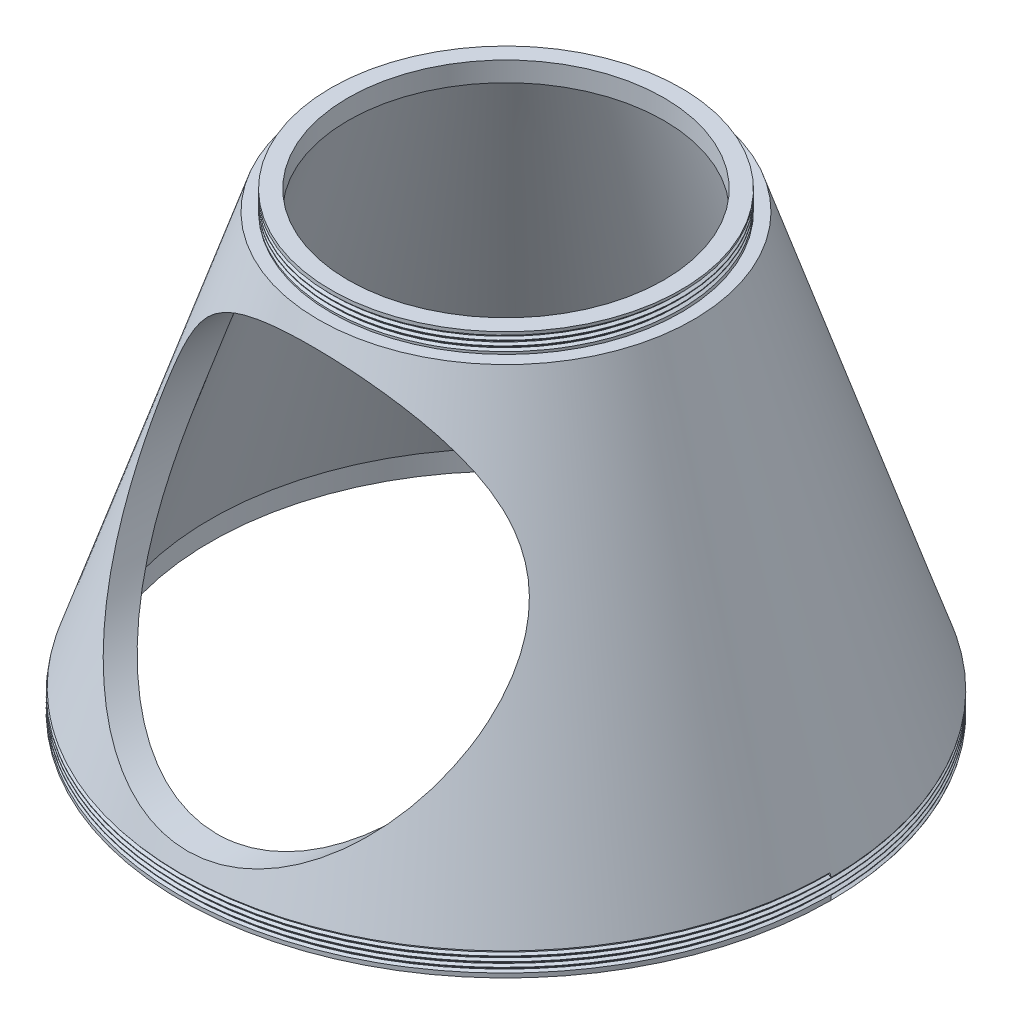
from build123d import *
from build123d.topology import SkipClean

# Parameters (mm, degrees)
SKETCH6_R            = 9.525
SKETCH6_R_2          = 7.65
BOSS_EXTRUDE3_DEPTH  = 46.25
SKETCH12_R           = 16.525
SKETCH12_R_2         = 15.025
BOSS_EXTRUDE10_DEPTH = 1
THREAD1_PITCH        = 0.25
CUT_EXTRUDE1_START   = -60
SKETCH15_R           = 7.65
CUT_EXTRUDE1_DEPTH   = 60
SKETCH17_R           = 7.65
SKETCH17_R_2         = 6
BOSS_EXTRUDE12_DEPTH = 1
SKETCH18_R           = 9.525
SKETCH18_R_2         = 8.025
BOSS_EXTRUDE14_DEPTH = 1
CUT_EXTRUDE2_START   = -1
SKETCH19_R           = 9.525
SKETCH19_R_2         = 8.895
CUT_EXTRUDE2_DEPTH   = 1
THREAD2_PITCH        = 0.25
CUT_EXTRUDE3_START   = -53
SKETCH20_R           = 9.525
CUT_EXTRUDE3_DEPTH   = 53


with BuildPart() as part:
    # Sketch6 → Boss-Extrude3 (new body)
    with BuildSketch(Plane.XY):
        Circle(SKETCH6_R)
        Circle(SKETCH6_R_2, mode=Mode.SUBTRACT)
    extrude(amount=BOSS_EXTRUDE3_DEPTH)

    # Sketch10 → Revolve1 (revolve)
    with BuildSketch(Plane(origin=(0, 0, 0), x_dir=(0, 0, -1), z_dir=(1, 0, 0))):
        Polygon((-8.5, -10.525), (-1.5, 10.525), (0, 10.525), (-7, -10.525), align=None)
    revolve(axis=Axis((0, 15.633745637, -8.025), (0, -1, 0)))

    # Sketch12 → Boss-Extrude10 (add)
    with BuildSketch(Plane.XZ.offset(10.525)):
        with Locations(Location((0, -8.025, 0), (0, 0, 270))):
            Circle(SKETCH12_R)
        with Locations(Location((0, -8.025, 0), (0, 0, 90))):
            Circle(SKETCH12_R_2, mode=Mode.SUBTRACT)
    extrude(amount=BOSS_EXTRUDE10_DEPTH)

    # Thread1: arcs per turn and ends read off the stored shape
    # Thread1: the profile of Thread Profile1 profile screwed along a right-hand helix through 4 turns, 6 arcs to a turn; built about Z, then put on its axis
    thread1_z = Axis((0, 0, 0), (0, 0, 1))
    thread1_corners = [(16.5253, 0, -0.000173205), (16.5253, 0, 0.218923204), (16.389683531, 0, 0.140625), (16.389683531, 0, 0.078125)]
    with BuildLine(mode=Mode.PRIVATE) as thread1_profile:
        Line(thread1_corners[0], thread1_corners[1])
        Line(thread1_corners[1], thread1_corners[2])
        Line(thread1_corners[2], thread1_corners[3])
        Line(thread1_corners[3], thread1_corners[0])
    thread1_cap = Face(thread1_profile.wire())
    thread1_turn_angles = [0, 30, 60, 90, 120, 150, 180, 210, 240, 270, 300, 330, 360]
    thread1_turn_weights = [1, 0.8660254037844387, 1, 0.8660254037844387, 1, 0.8660254037844387, 1, 0.8660254037844387, 1, 0.8660254037844387, 1, 0.8660254037844387, 1]
    thread1_turn_rails = [Edge.make_bspline([Vector(p[0], p[1], 0).rotate(thread1_z, thread1_turn_angles[k]) / thread1_turn_weights[k] + Vector(0, 0, p[2] + THREAD1_PITCH * thread1_turn_angles[k] / 360) for k in range(13)], [0, 0, 0, 1, 1, 2, 2, 3, 3, 4, 4, 5, 5, 6, 6, 6], 2, thread1_turn_weights) for p in thread1_corners]
    thread1_turn_sides = [Face.make_surface_from_curves(thread1_turn_rails[p[0]], thread1_turn_rails[p[1]]) for p in [(0, 1), (1, 2), (2, 3), (3, 0)]]
    thread1 = Plane(origin=(0, -11.525, -8.025), x_dir=(1, 0, 0), z_dir=(0, 1, 0)) * Solid(Shell([*[p.moved(Location((0, 0, THREAD1_PITCH * i))) for i in range(4) for p in thread1_turn_sides], thread1_cap, thread1_cap.rotate(thread1_z, 1440).moved(Location((0, 0, THREAD1_PITCH * 1440 / 360)))]))
    add(thread1, mode=Mode.SUBTRACT)

    # Sketch15 → Cut-Extrude1 (cut)
    with SkipClean():  # the faces are left unmerged after this step: merging them gives an invalid solid
        with BuildSketch(Plane.XY.offset(46.25).offset(CUT_EXTRUDE1_START)):
            with Locations(Location((0, 0, 0), (0, 0, 166.998507046))):
                Circle(SKETCH15_R)
        extrude(amount=CUT_EXTRUDE1_DEPTH, mode=Mode.SUBTRACT)

    # Sketch17 → Boss-Extrude12 (add)
    with SkipClean():  # the faces are left unmerged after this step: merging them gives an invalid solid
        with BuildSketch(Plane(origin=(0, 0, 0), x_dir=(-1, 0, 0), z_dir=(0, 0, -1))):
            Circle(SKETCH17_R)
            Circle(SKETCH17_R_2, mode=Mode.SUBTRACT)
        extrude(amount=-BOSS_EXTRUDE12_DEPTH)

    # Sketch18 → Boss-Extrude14 (add)
    with SkipClean():  # the faces are left unmerged after this step: merging them gives an invalid solid
        with BuildSketch(Plane(origin=(0, 10.525, 0), x_dir=(1, 0, 0), z_dir=(0, 1, 0))):
            with Locations(Location((0, 8.025, 0), (0, 0, 270))):
                Circle(SKETCH18_R)
            with Locations(Location((0, 8.025, 0), (0, 0, 270))):
                Circle(SKETCH18_R_2, mode=Mode.SUBTRACT)
        extrude(amount=BOSS_EXTRUDE14_DEPTH)
    add(part.part.scale(1), mode=Mode.REPLACE)  # the faces are merged on a copy

    # Sketch19 → Cut-Extrude2 (cut)
    with BuildSketch(Plane(origin=(0, 11.525, 0), x_dir=(1, 0, 0), z_dir=(0, 1, 0)).offset(CUT_EXTRUDE2_START)):
        with Locations((0, 8.025)):
            Circle(SKETCH19_R)
        with Locations(Location((0, 8.025, 0), (0, 0, 270))):
            Circle(SKETCH19_R_2, mode=Mode.SUBTRACT)
    extrude(amount=CUT_EXTRUDE2_DEPTH, mode=Mode.SUBTRACT)

    # Thread2: arcs per turn and ends read off the stored shape
    # Thread2: the profile of Thread Profile2 profile screwed along a right-hand helix through 3.2 turns, 6 arcs to a turn; built about Z, then put on its axis
    thread2_z = Axis((0, 0, 0), (0, 0, 1))
    thread2_corners = [(8.8953, 0, -0.000173205), (8.8953, 0, 0.218923204), (8.759683531, 0, 0.140625), (8.759683531, 0, 0.078125)]
    with BuildLine(mode=Mode.PRIVATE) as thread2_profile:
        Line(thread2_corners[0], thread2_corners[1])
        Line(thread2_corners[1], thread2_corners[2])
        Line(thread2_corners[2], thread2_corners[3])
        Line(thread2_corners[3], thread2_corners[0])
    thread2_cap = Face(thread2_profile.wire())
    thread2_turn_angles = [0, 30, 60, 90, 120, 150, 180, 210, 240, 270, 300, 330, 360]
    thread2_turn_weights = [1, 0.8660254037844387, 1, 0.8660254037844387, 1, 0.8660254037844387, 1, 0.8660254037844387, 1, 0.8660254037844387, 1, 0.8660254037844387, 1]
    thread2_turn_rails = [Edge.make_bspline([Vector(p[0], p[1], 0).rotate(thread2_z, thread2_turn_angles[k]) / thread2_turn_weights[k] + Vector(0, 0, p[2] + THREAD2_PITCH * thread2_turn_angles[k] / 360) for k in range(13)], [0, 0, 0, 1, 1, 2, 2, 3, 3, 4, 4, 5, 5, 6, 6, 6], 2, thread2_turn_weights) for p in thread2_corners]
    thread2_turn_sides = [Face.make_surface_from_curves(thread2_turn_rails[p[0]], thread2_turn_rails[p[1]]) for p in [(0, 1), (1, 2), (2, 3), (3, 0)]]
    thread2_last_angles = [1080, 1110, 1140, 1146, 1152]
    thread2_last_weights = [1, 0.8660254037844387, 1, 0.9945218953682733, 1]
    thread2_last_rails = [Edge.make_bspline([Vector(p[0], p[1], 0).rotate(thread2_z, thread2_last_angles[k]) / thread2_last_weights[k] + Vector(0, 0, p[2] + THREAD2_PITCH * thread2_last_angles[k] / 360) for k in range(5)], [0, 0, 0, 1, 1, 2, 2, 2], 2, thread2_last_weights) for p in thread2_corners]
    thread2_last_sides = [Face.make_surface_from_curves(thread2_last_rails[p[0]], thread2_last_rails[p[1]]) for p in [(0, 1), (1, 2), (2, 3), (3, 0)]]
    thread2 = Plane(origin=(0, 11.525, -8.025), x_dir=(-1, 0, 0), z_dir=(0, -1, 0)) * Solid(Shell([*[p.moved(Location((0, 0, THREAD2_PITCH * i))) for i in range(3) for p in thread2_turn_sides], *thread2_last_sides, thread2_cap, thread2_cap.rotate(thread2_z, 1152).moved(Location((0, 0, THREAD2_PITCH * 1152 / 360)))]))
    add(thread2, mode=Mode.SUBTRACT)

    # Sketch20 → Cut-Extrude3 (cut)
    with BuildSketch(Plane.XY.offset(46.25).offset(CUT_EXTRUDE3_START)):
        with Locations(Location((0, 0, 0), (0, 0, 346.61669325))):
            Circle(SKETCH20_R)
    extrude(amount=CUT_EXTRUDE3_DEPTH, mode=Mode.SUBTRACT)


solid = part.part
